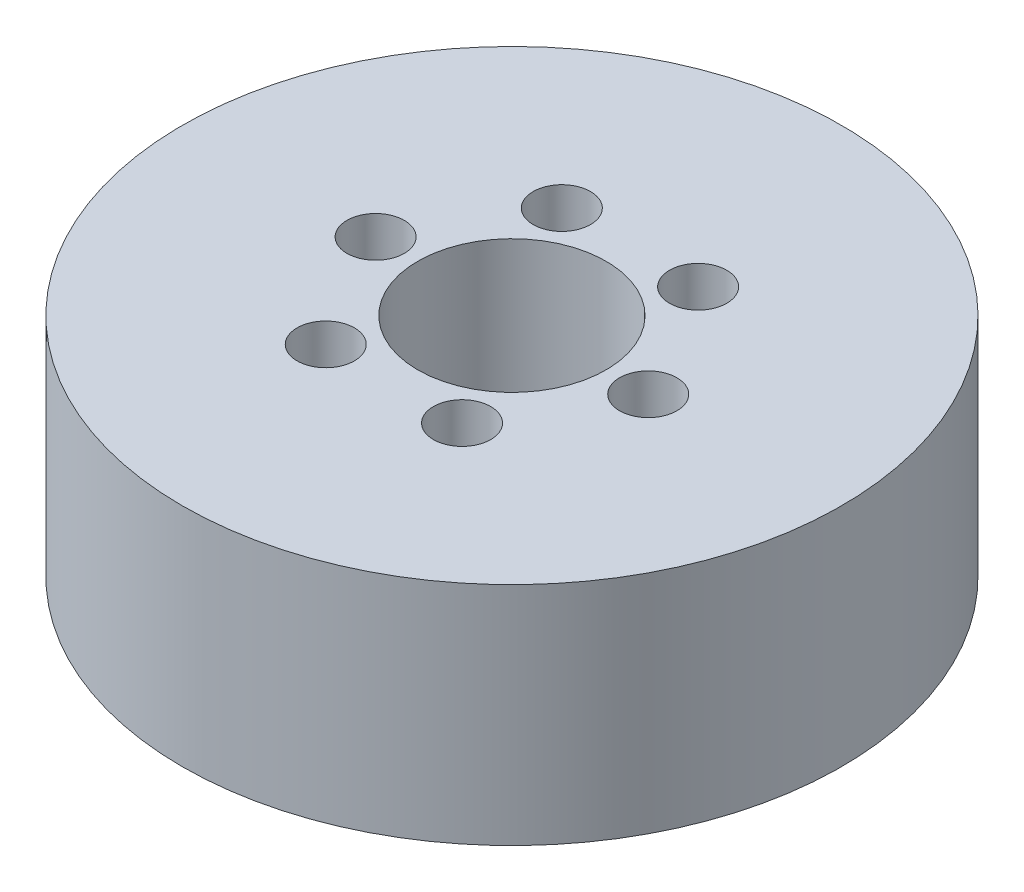
from build123d import *

# Parameters (mm, degrees)
SKETCH1_R           = 17.5
BOSS_EXTRUDE1_DEPTH = 12
SKETCH2_R           = 5
CUT_EXTRUDE1_DEPTH  = 28.504545079
SKETCH3_R           = 1.521677367
CUT_EXTRUDE2_DEPTH  = 10.736940053
CIRPATTERN1_COUNT   = 6


with BuildPart() as part:
    # Sketch1 → Boss-Extrude1 (new body)
    with BuildSketch(Plane(origin=(0, 0, 0), x_dir=(1, 0, 0), z_dir=(0, 1, 0))):
        Circle(SKETCH1_R)
    extrude(amount=BOSS_EXTRUDE1_DEPTH)

    # Sketch2 → Cut-Extrude1 (cut, through all)
    with BuildSketch(Plane(origin=(0, 0, 0), x_dir=(1, 0, 0), z_dir=(0, 1, 0))):
        Circle(SKETCH2_R)
    extrude(amount=CUT_EXTRUDE1_DEPTH, mode=Mode.SUBTRACT)

    # Sketch3 → Cut-Extrude2 (cut)
    with BuildSketch(Plane(origin=(0, 12, 0), x_dir=(1, 0, 0), z_dir=(0, 1, 0))):
        with Locations((-7.237560426, 0)):
            Circle(SKETCH3_R)
    cut_extrude2 = extrude(amount=-CUT_EXTRUDE2_DEPTH, mode=Mode.SUBTRACT)

    # CirPattern1: Cut-Extrude2 ×6 about axis
    cirpattern1_axis = Axis((0, 0, 0), (0, 1, 0))
    for i in range(1, CIRPATTERN1_COUNT):
        add(cut_extrude2.rotate(cirpattern1_axis, i * 360 / CIRPATTERN1_COUNT), mode=Mode.SUBTRACT)


solid = part.part
